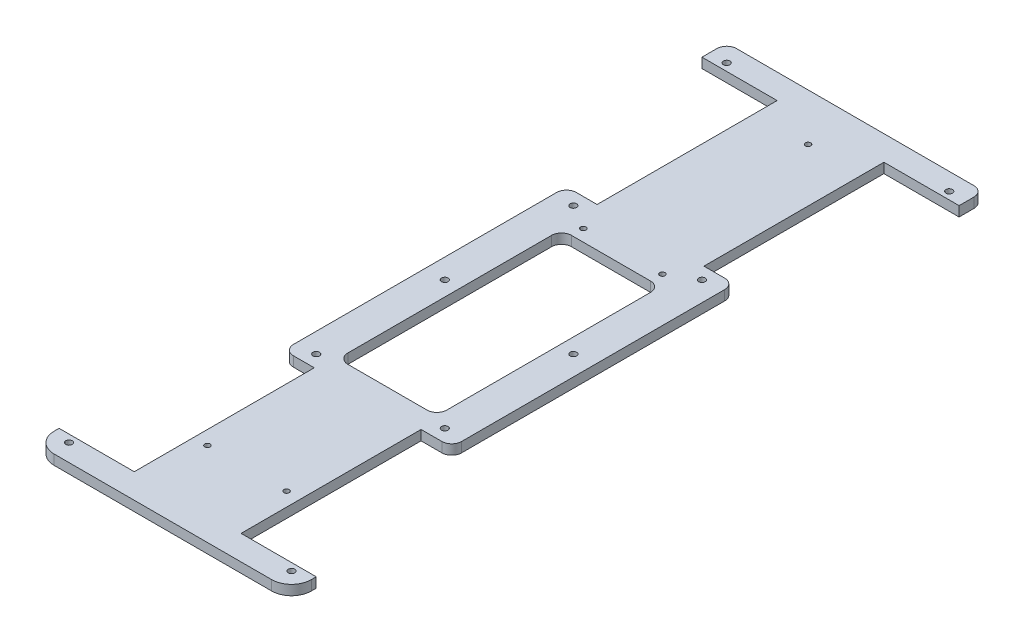
from build123d import *

# Parameters (mm, degrees)
BOSS_EXTRUDE1_DEPTH = 5
FILLET1_R           = 10
FILLET2_R           = 5
SKETCH2_R           = 1.65
CUT_EXTRUDE1_DEPTH  = 374.396572025
SKETCH3_R           = 1.65
CUT_EXTRUDE2_DEPTH  = 374.396572025
SKETCH4_R           = 1.65
CUT_EXTRUDE3_DEPTH  = 374.396572025
SKETCH5_R           = 1.35
CUT_EXTRUDE4_DEPTH  = 10
SKETCH6_W           = 50
SKETCH6_H           = 113
CUT_EXTRUDE5_DEPTH  = 10
FILLET4_R           = 5


with BuildPart() as part:
    # Sketch1 → Boss-Extrude1 (new body)
    with BuildSketch(Plane(origin=(0, 0, 0), x_dir=(1, 0, 0), z_dir=(0, 1, 0))):
        Polygon((0, 0), (130, 0), (130, 12.5), (92, 12.5), (92, 103.5), (107.5, 103.5), (107.5, 246.5), (92, 246.5), (92, 337.5), (130, 337.5), (130, 350), (0, 350), (0, 337.5), (38, 337.5), (38, 246.5), (22.5, 246.5), (22.5, 103.5), (38, 103.5), (38, 12.5), (0, 12.5), align=None)
    extrude(amount=BOSS_EXTRUDE1_DEPTH)

    # Fillet1
    fillet1_edges = [part.edges().sort_by_distance(p)[0] for p in [
        (130, 2.5, 0),
        (0, 2.5, 0),
    ]]
    fillet(fillet1_edges, radius=FILLET1_R)

    # Fillet2
    fillet2_edges = [part.edges().sort_by_distance(p)[0] for p in [
        (0, 2.5, -350),
        (130, 2.5, -350),
        (107.5, 2.5, -246.5),
        (107.5, 2.5, -103.5),
        (22.5, 2.5, -103.5),
        (22.5, 2.5, -246.5),
    ]]
    fillet(fillet2_edges, radius=FILLET2_R)

    # Sketch2 → Cut-Extrude1 (cut, through all)
    with BuildSketch(Plane(origin=(0, 5, 0), x_dir=(1, 0, 0), z_dir=(0, 1, 0))):
        with Locations((32.5, 240)):
            Circle(SKETCH2_R)
        with Locations((32.5, 175)):
            Circle(SKETCH2_R)
        with Locations((32.5, 110)):
            Circle(SKETCH2_R)
        with Locations((97.5, 110)):
            Circle(SKETCH2_R)
        with Locations((97.5, 175)):
            Circle(SKETCH2_R)
        with Locations((97.5, 240)):
            Circle(SKETCH2_R)
    extrude(amount=-CUT_EXTRUDE1_DEPTH, mode=Mode.SUBTRACT)

    # Sketch3 → Cut-Extrude2 (cut, through all)
    with BuildSketch(Plane(origin=(0, 5, 0), x_dir=(1, 0, 0), z_dir=(0, 1, 0))):
        with Locations((8.75, 8.75)):
            Circle(SKETCH3_R)
        with Locations((121.25, 8.75)):
            Circle(SKETCH3_R)
    extrude(amount=-CUT_EXTRUDE2_DEPTH, mode=Mode.SUBTRACT)

    # Sketch4 → Cut-Extrude3 (cut, through all)
    with BuildSketch(Plane(origin=(0, 5, 0), x_dir=(1, 0, 0), z_dir=(0, 1, 0))):
        with Locations((8.75, 341.25)):
            Circle(SKETCH4_R)
        with Locations((121.25, 341.25)):
            Circle(SKETCH4_R)
    extrude(amount=-CUT_EXTRUDE3_DEPTH, mode=Mode.SUBTRACT)

    # Sketch5 → Cut-Extrude4 (cut)
    with BuildSketch(Plane(origin=(0, 5, 0), x_dir=(1, 0, 0), z_dir=(0, 1, 0))):
        with Locations((45, 42.5)):
            Circle(SKETCH5_R)
        with Locations((85, 42.5)):
            Circle(SKETCH5_R)
        with Locations((45, 232.5)):
            Circle(SKETCH5_R)
        with Locations((85, 232.5)):
            Circle(SKETCH5_R)
        with Locations((65, 326.15)):
            Circle(SKETCH5_R)
    extrude(amount=-CUT_EXTRUDE4_DEPTH, mode=Mode.SUBTRACT)

    # Sketch6 → Cut-Extrude5 (cut)
    with BuildSketch(Plane(origin=(0, 5, 0), x_dir=(1, 0, 0), z_dir=(0, 1, 0))):
        with Locations((65, 170)):
            Rectangle(SKETCH6_W, SKETCH6_H)
    extrude(amount=-CUT_EXTRUDE5_DEPTH, mode=Mode.SUBTRACT)

    # Fillet4
    fillet4_edges = [part.edges().sort_by_distance(p)[0] for p in [
        (90, 2.5, -113.5),
        (40, 2.5, -113.5),
        (90, 2.5, -226.5),
        (40, 2.5, -226.5),
    ]]
    fillet(fillet4_edges, radius=FILLET4_R)


solid = part.part
